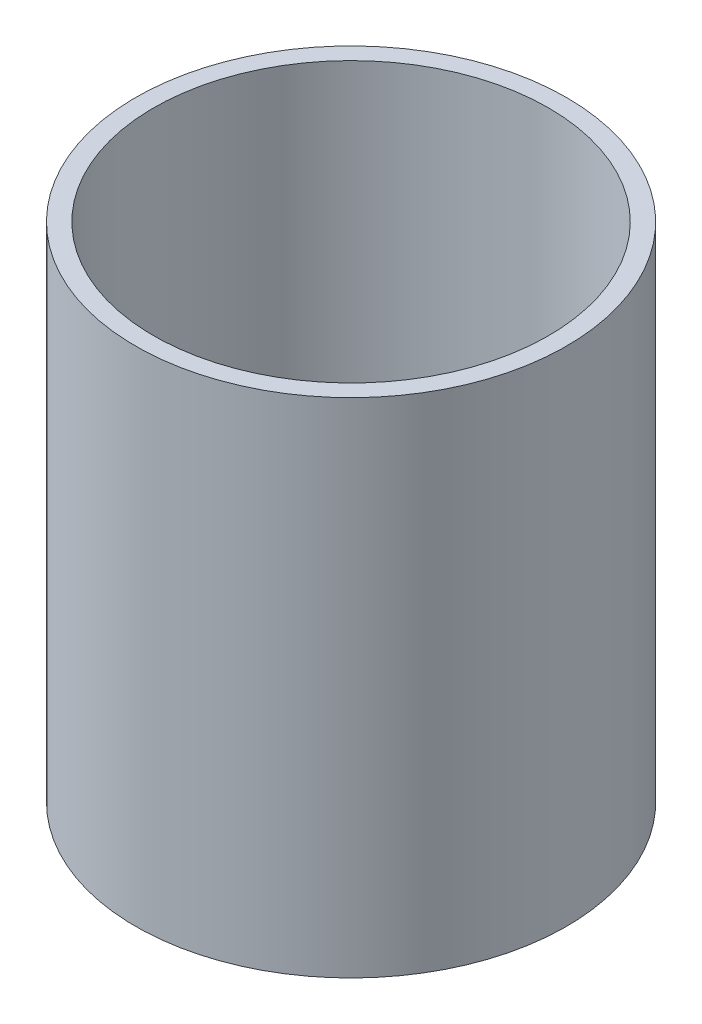
from build123d import *

# Parameters (mm, degrees)
SKETCH1_R           = 18
BOSS_EXTRUDE1_DEPTH = 42
SKETCH4_R           = 16.5
CUT_EXTRUDE2_DEPTH  = 42


with BuildPart() as part:
    # Sketch1 → Boss-Extrude1 (new body)
    with BuildSketch(Plane(origin=(0, 0, 0), x_dir=(1, 0, 0), z_dir=(0, 1, 0))):
        Circle(SKETCH1_R)
    extrude(amount=BOSS_EXTRUDE1_DEPTH)

    # Sketch4 → Cut-Extrude2 (cut)
    with BuildSketch(Plane.XZ):
        Circle(SKETCH4_R)
    extrude(amount=-CUT_EXTRUDE2_DEPTH, mode=Mode.SUBTRACT)


solid = part.part
